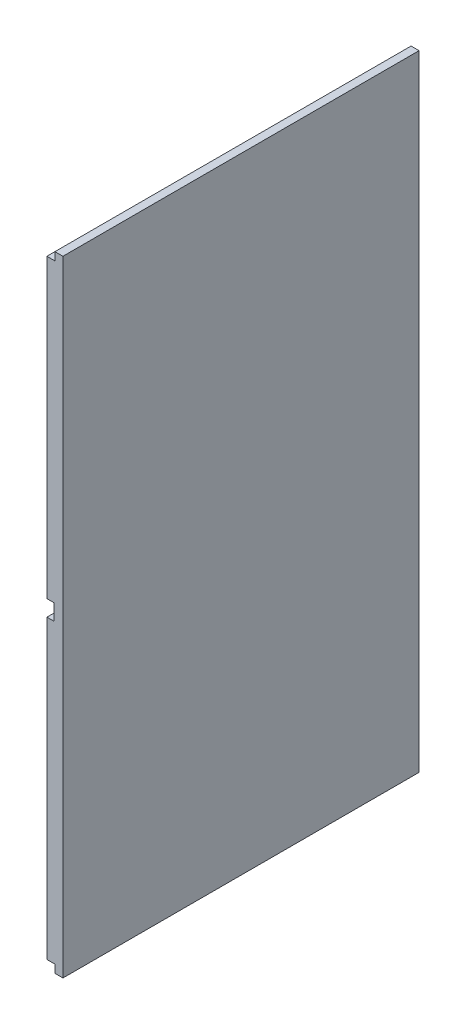
from build123d import *

# Parameters (mm, degrees)
SKETCH1_W           = 400
SKETCH1_H           = 702
BOSS_EXTRUDE1_DEPTH = 18
SKETCH2_W           = 400
SKETCH2_H           = 9
CUT_EXTRUDE1_DEPTH  = 9
SKETCH3_W           = 400
SKETCH3_H           = 18
CUT_EXTRUDE2_DEPTH  = 8


with BuildPart() as part:
    # Sketch1 → Boss-Extrude1 (new body)
    with BuildSketch(Plane(origin=(0, 0, 0), x_dir=(0, 0, -1), z_dir=(1, 0, 0))):
        Rectangle(SKETCH1_W, SKETCH1_H)
    extrude(amount=BOSS_EXTRUDE1_DEPTH)

    # Sketch2 → Cut-Extrude1 (cut)
    with BuildSketch(Plane.ZY):
        with Locations((0, -346.5)):
            Rectangle(SKETCH2_W, SKETCH2_H)
        with Locations((0, 346.5)):
            Rectangle(SKETCH2_W, SKETCH2_H)
    extrude(amount=-CUT_EXTRUDE1_DEPTH, mode=Mode.SUBTRACT)

    # Sketch3 → Cut-Extrude2 (cut)
    with BuildSketch(Plane.ZY):
        Rectangle(SKETCH3_W, SKETCH3_H)
    extrude(amount=-CUT_EXTRUDE2_DEPTH, mode=Mode.SUBTRACT)


solid = part.part
